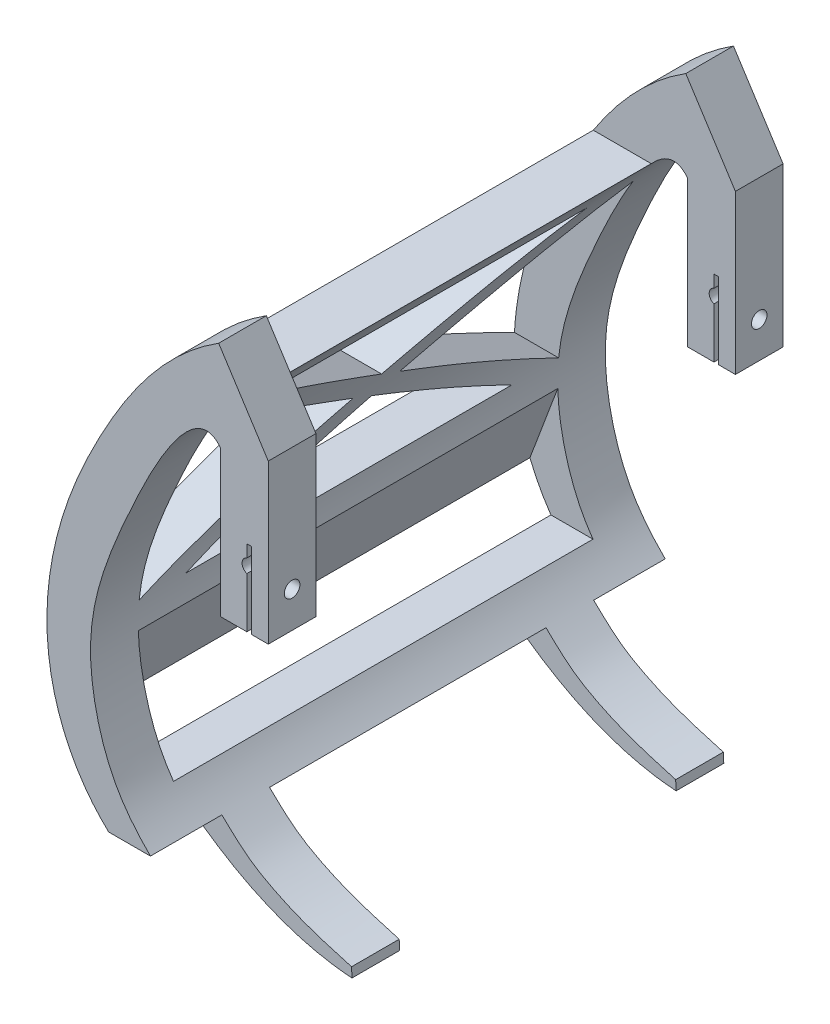
from build123d import *

# Parameters (mm, degrees)
BOSS_EXTRUDE1_DEPTH      = 108
CUT_EXTRUDE1_START       = -46.410348872
CUT_EXTRUDE1_OUTLINE_W   = 88
CUT_EXTRUDE1_OUTLINE_H   = 30
CUT_EXTRUDE1_OUTLINE_H_2 = 24.348198975
CUT_EXTRUDE1_OUTLINE_W_2 = 15
CUT_EXTRUDE1_OUTLINE_H_3 = 16
CUT_EXTRUDE1_OUTLINE_W_3 = 58
CUT_EXTRUDE1_DEPTH       = 48.972569244
CUT_EXTRUDE2_DEPTH       = 147.524282774
SKETCH7_W                = 3.5
SKETCH7_H                = 10
BOSS_EXTRUDE5_DEPTH      = 4
SKETCH12_W               = 2
SKETCH12_H               = 10
BOSS_EXTRUDE6_DEPTH      = 34
SKETCH5_R                = 1.63195
CUT_EXTRUDE3_DEPTH       = 14
CUT_EXTRUDE20_DEPTH      = 11
BOSS_EXTRUDE4_START      = -98
BOSS_EXTRUDE4_DEPTH      = 88
CUT_EXTRUDE22_START      = -10
SKETCH14_R               = 3
CUT_EXTRUDE22_DEPTH      = 2


# Read off the part's stored shape, not the designer's step: Cut-Extrude1, Boss-Extrude4
with BuildPart() as part:
    # Sketch2 → Boss-Extrude1 (new body)
    with BuildSketch(Plane.XY):
        with BuildLine():
            Line((13.022202775, 95.549557252), (23.431, 79.340369812))
            Line((23.431, 79.340369812), (23.431, 50.07))
            Line((23.431, 50.07), (15.431, 50.07))
            Line((15.431, 50.07), (15.431, 72.592455195))
            add(Edge.make_bspline(
                [(15.431, 72.592455195), (10.149158829, 88.545318517), (-4.103242557, 60.01503365), (-12.665004198, 38.93715266), (-15.223327171, 24.31723963), (-9.785262922, 3.556090829), (1.974681884, -8.200837213), (7.204339336, -12.151661152), (17.506021959, -16.48180339), (25.898773367, -18.800873027)],
                knots=[0, 0, 0, 0, 0.234652889, 0.322770099, 0.493633026, 0.638260734, 0.773901483, 0.925773392, 1, 1, 1, 1], degree=3))
            Line((25.898773367, -18.800873027), (25.993220372, -20.798641723))
            add(Edge.make_bspline(
                [(13.022202775, 95.549557252), (1.831488934, 88.474452463), (-10.063942327, 71.538532508), (-22.406541259, 43.654752309), (-24.611250505, 18.586232324), (-15.081682968, -1.199187466), (1.69050755, -14.5115831), (15.828737243, -20.138512116), (25.993220372, -20.798641723)],
                knots=[0, 0, 0, 0, 0.247687481, 0.395883505, 0.590119201, 0.71285843, 0.804022032, 1, 1, 1, 1], degree=3))
        make_face()
    extrude(amount=BOSS_EXTRUDE1_DEPTH)

    # Cut-Extrude1 outline → Cut-Extrude1 (cut)
    with BuildSketch(Plane(origin=(23.431, 0, 0), x_dir=(0, 0, -1), z_dir=(1, 0, 0)).offset(CUT_EXTRUDE1_START)):
        with Locations((-54, 90.549557252)):
            Rectangle(CUT_EXTRUDE1_OUTLINE_W, CUT_EXTRUDE1_OUTLINE_H)
        Polygon((-58.888888889, 50.549557252), (-98, 70.549557252), (-98, 30.549557252), align=None)
        Polygon((-19.777777778, 70.549557252), (-88.222222222, 70.549557252), (-54, 53.049557252), align=None)
        Polygon((-10, 70.549557252), (-49.111111111, 50.549557252), (-10, 30.549557252), align=None)
        with Locations((-54, 13.375457765)):
            Rectangle(CUT_EXTRUDE1_OUTLINE_W, CUT_EXTRUDE1_OUTLINE_H_2)
        Polygon((-54, 48.049557252), (-88.222222222, 30.549557252), (-19.777777778, 30.549557252), align=None)
        with Locations((-100.5, -12.798641723)):
            Rectangle(CUT_EXTRUDE1_OUTLINE_W_2, CUT_EXTRUDE1_OUTLINE_H_3)
        with Locations((-7.5, -12.798641723)):
            Rectangle(CUT_EXTRUDE1_OUTLINE_W_2, CUT_EXTRUDE1_OUTLINE_H_3)
        with Locations((-54, -12.798641723)):
            Rectangle(CUT_EXTRUDE1_OUTLINE_W_3, CUT_EXTRUDE1_OUTLINE_H_3)
    extrude(amount=CUT_EXTRUDE1_DEPTH, mode=Mode.SUBTRACT)

    # Sketch4 → Cut-Extrude2 (cut, through all)
    with BuildSketch(Plane(origin=(0, 0, 0), x_dir=(-1, 0, 0), z_dir=(0, 0, -1))):
        Polygon((-19.931, 50.07), (-18.931, 50.07), (-18.931, 56.655786438), (-18.931, 59.484213562), (-18.931, 62.07), (-19.931, 62.07), align=None)
        with BuildLine():
            Line((-18.931, 59.484213562), (-18.931, 56.655786438))
            ThreePointArc((-18.931, 56.655786438), (-17.931, 58.07), (-18.931, 59.484213562))
        make_face()
    extrude(amount=-CUT_EXTRUDE2_DEPTH, mode=Mode.SUBTRACT)

    # Sketch7 → Boss-Extrude5 (add)
    with BuildSketch(Plane.XZ.offset(-50.07)):
        with Locations((21.681, 5)):
            Rectangle(SKETCH7_W, SKETCH7_H)
        with Locations((17.181, 5)):
            Rectangle(SKETCH7_W, SKETCH7_H)
        with Locations((21.681, 103)):
            Rectangle(SKETCH7_W, SKETCH7_H)
        with Locations((17.181, 103)):
            Rectangle(SKETCH7_W, SKETCH7_H)
    extrude(amount=BOSS_EXTRUDE5_DEPTH)

    # Sketch12 → Boss-Extrude6 (add)
    with BuildSketch(Plane.XZ.offset(-46.07)):
        with Locations((14.431, 5)):
            Rectangle(SKETCH12_W, SKETCH12_H)
        with Locations((14.431, 103)):
            Rectangle(SKETCH12_W, SKETCH12_H)
    extrude(amount=-BOSS_EXTRUDE6_DEPTH)

    # Sketch5 → Cut-Extrude3 (cut)
    with BuildSketch(Plane(origin=(23.431, 0, 0), x_dir=(0, 0, -1), z_dir=(1, 0, 0))):
        with Locations(Location((-5, 53.57, 0), (0, 0, 180))):
            Circle(SKETCH5_R)
        with Locations(Location((-103, 53.57, 0), (0, 0, 180))):
            Circle(SKETCH5_R)
    extrude(amount=-CUT_EXTRUDE3_DEPTH, mode=Mode.SUBTRACT)

    # Sketch3<3> → Cut-Extrude20 (cut)
    with BuildSketch(Plane(origin=(23.431, 0, 0), x_dir=(0, 0, -1), z_dir=(1, 0, 0))):
        Polygon((-88.222222222, 70.549557252), (-98, 75.549557252), (-98, 70.549557252), align=None)
        Polygon((-10, 75.549557252), (-98, 75.549557252), (-88.222222222, 70.549557252), (-19.777777778, 70.549557252), align=None)
        Polygon((-10, 70.549557252), (-10, 75.549557252), (-19.777777778, 70.549557252), align=None)
        Polygon((-49.111111111, 50.549557252), (-10, 70.549557252), (-19.777777778, 70.549557252), (-54, 53.049557252), align=None)
        Polygon((-88.222222222, 70.549557252), (-98, 70.549557252), (-58.888888889, 50.549557252), (-54, 53.049557252), align=None)
        Polygon((-54, 53.049557252), (-58.888888889, 50.549557252), (-57.95108804, 50.07), (-50.04891196, 50.07), (-49.111111111, 50.549557252), align=None)
        Polygon((-57.95108804, 50.07), (-58.888888889, 50.549557252), (-59.826689738, 50.07), align=None)
        Polygon((-48.173310262, 50.07), (-49.111111111, 50.549557252), (-50.04891196, 50.07), align=None)
    extrude(amount=-CUT_EXTRUDE20_DEPTH, mode=Mode.SUBTRACT)

    # Boss-Extrude4 outline → Boss-Extrude4 (add)
    with BuildSketch(Plane(origin=(0, 0, 0), x_dir=(-1, 0, 0), z_dir=(0, 0, -1)).offset(BOSS_EXTRUDE4_START)):
        with BuildLine():
            add(Edge.make_bspline(
                [(22.979348772, 25.549557252), (22.866368513, 22.120531022), (22.162637315, 16.632995199), (20.460556194, 11.337881494), (19.675865235, 9.390031402)],
                knots=[0.524188426, 0.524188426, 0.524188426, 0.524188426, 0.590119201, 0.630331135, 0.630331135, 0.630331135, 0.630331135], degree=3))
            Line((22.979348772, 25.549557252), (13.85196619, 25.549557252))
            add(Edge.make_bspline(
                [(13.834906734, 24.891788232), (13.842259913, 25.111754033), (13.847941433, 25.330992757), (13.85196619, 25.549557252)],
                knots=[0.526155485, 0.526155485, 0.526155485, 0.526155485, 0.531596352, 0.531596352, 0.531596352, 0.531596352], degree=3))
            Line((13.834906734, 24.891788232), (19.675865235, 9.390031402))
        make_face()
    extrude(amount=BOSS_EXTRUDE4_DEPTH)

    # Sketch14 → Cut-Extrude22 (cut)
    with BuildSketch(Plane(origin=(23.431, 0, 0), x_dir=(0, 0, -1), z_dir=(1, 0, 0)).offset(CUT_EXTRUDE22_START)):
        with Locations(Location((-5, 53.57, 0), (0, 0, 180))):
            Circle(SKETCH14_R)
        with Locations(Location((-103, 53.57, 0), (0, 0, 180))):
            Circle(SKETCH14_R)
    extrude(amount=CUT_EXTRUDE22_DEPTH, mode=Mode.SUBTRACT)


solid = part.part
